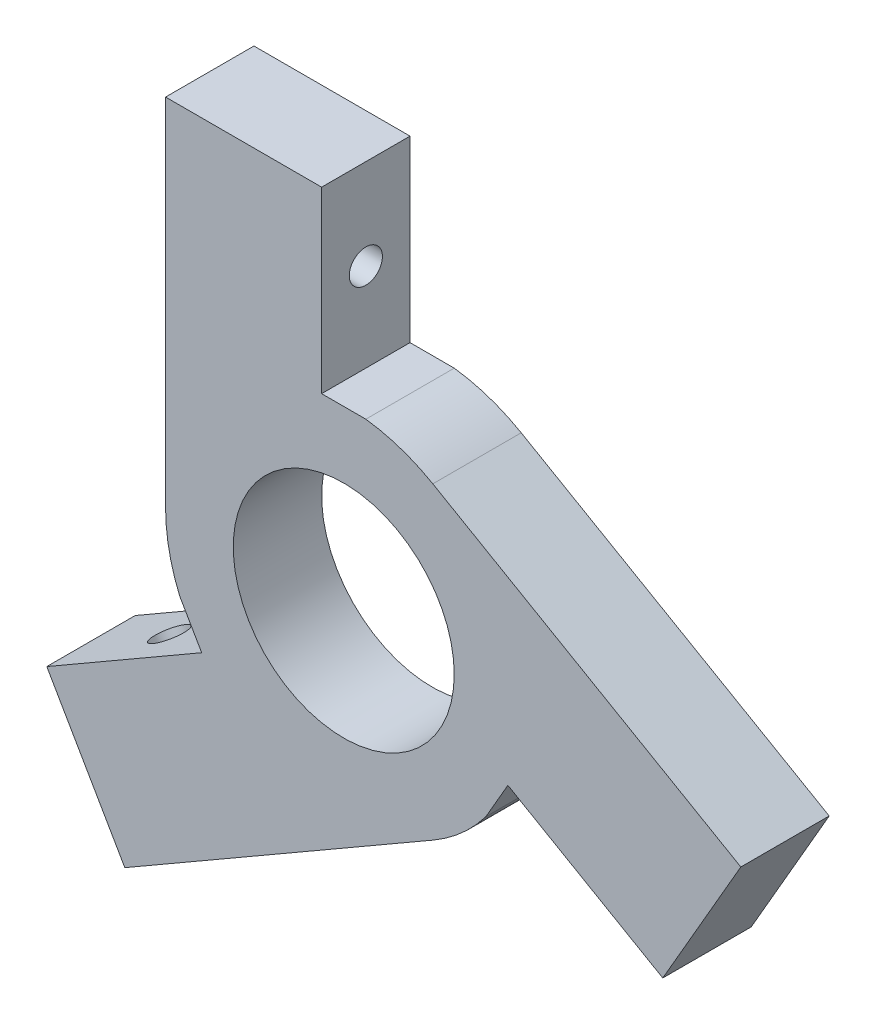
from build123d import *

# Parameters (mm, degrees)
SKETCH1_R           = 31.75
BOSS_EXTRUDE1_DEPTH = 12.7
SKETCH2_R           = 4.7625
CUT_EXTRUDE1_DEPTH  = 25.4
CIRPATTERN1_COUNT   = 3


with BuildPart() as part:
    # Sketch1 → Boss-Extrude1 (new, symmetric)
    with BuildSketch(Plane.XY):
        with BuildLine():
            Line((-51.195336702, 0), (-51.195336702, 102.193578565))
            Line((-51.195336702, 102.193578565), (-6.35, 102.193578565))
            Line((-6.35, 102.193578565), (-6.35, 50.8))
            Line((-6.35, 50.8), (6.35, 50.8))
            ThreePointArc((6.35, 50.8), (16.297475531, 48.531997603), (25.597668351, 44.336462139))
            Line((25.597668351, 44.336462139), (114.099903492, -6.760327144))
            Line((114.099903492, -6.760327144), (91.677235141, -45.597527969))
            Line((91.677235141, -45.597527969), (47.169090512, -19.900738686))
            Line((47.169090512, -19.900738686), (40.819090512, -30.899261314))
            ThreePointArc((40.819090512, -30.899261314), (33.881205055, -38.380026629), (25.597668351, -44.336462139))
            Line((25.597668351, -44.336462139), (-62.90456679, -95.433251422))
            Line((-62.90456679, -95.433251422), (-85.327235141, -56.596050597))
            Line((-85.327235141, -56.596050597), (-40.819090512, -30.899261314))
            Line((-40.819090512, -30.899261314), (-47.169090512, -19.900738686))
            ThreePointArc((-47.169090512, -19.900738686), (-50.178680586, -10.151970974), (-51.195336702, 0))
        make_face()
        Circle(SKETCH1_R, mode=Mode.SUBTRACT)
    extrude(amount=BOSS_EXTRUDE1_DEPTH, both=True)

    # Sketch2 → Cut-Extrude1 (cut)
    with BuildSketch(Plane(origin=(-6.35, 0, 0), x_dir=(0, 0, -1), z_dir=(1, 0, 0))):
        with Locations((0, 76.2)):
            Circle(SKETCH2_R)
    cut_extrude1 = extrude(amount=-CUT_EXTRUDE1_DEPTH, mode=Mode.SUBTRACT)

    # CirPattern1: Cut-Extrude1 ×3 about axis
    cirpattern1_axis = Axis((0, 0, 12.7), (0, 0, 1))
    for i in range(1, CIRPATTERN1_COUNT):
        add(cut_extrude1.rotate(cirpattern1_axis, i * 360 / CIRPATTERN1_COUNT), mode=Mode.SUBTRACT)


solid = part.part
